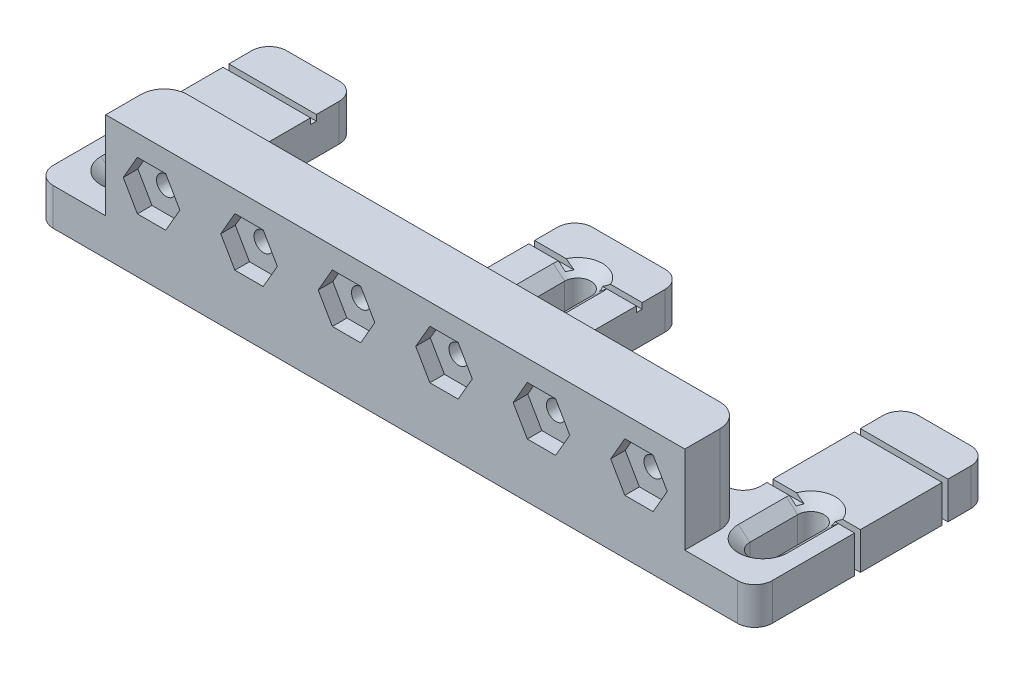
from build123d import *

# Parameters (mm, degrees)
SKETCH1_W                                    = 61.6
SKETCH1_H                                    = 40
BOSS_EXTRUDE1_DEPTH                          = 6.35
CSK_SLOT_FOR_8_FLAT_HEAD_MACHINE_SCREW_DEPTH = 6.35
FILLET1_R                                    = 3
SKETCH4_W                                    = 10
SKETCH4_H                                    = 15
BOSS_EXTRUDE2_DEPTH                          = 49.6
CUT_EXTRUDE1_DEPTH                           = 2.5
CUT_EXTRUDE2_DEPTH                           = 72.766165426
CUT_EXTRUDE2_DEPTH_BACK                      = 72.766165426
SKETCH7_R                                    = 1.65
FILLET3_R                                    = 4
SKETCH15_W                                   = 1
SKETCH15_H                                   = 2
SKETCH20_W                                   = 1
SKETCH20_H                                   = 2
CSK_START                                    = -1
CSK_SLOT_FOR_8_FLAT_HEAD_MACHINE_SC_4_DEPTH  = 22.35
CUT_EXTRUDE3_DEPTH                           = 67.479771505
CUT_EXTRUDE3_DEPTH_BACK                      = 67.479771505
FILLET4_R                                    = 3


with BuildPart() as part:
    # Sketch1 → Boss-Extrude1 (new body)
    with BuildSketch(Plane(origin=(0, 0, 0), x_dir=(1, 0, 0), z_dir=(0, 1, 0))):
        with Locations((-30.8, 0)):
            Rectangle(SKETCH1_W, SKETCH1_H)
    extrude(amount=BOSS_EXTRUDE1_DEPTH)

    # CSK SLOT for _8 Flat Head Machine Screw: read off the stored shape, not the designer's step
    # CSK SLOT for _8 Flat Head Machine Sc 2 → CSK SLOT for _8 Flat Head Machine Screw (cut)
    with BuildSketch(Plane(origin=(0, 0, 0), x_dir=(1, 0, 0), z_dir=(0, 1, 0))):
        with BuildLine():
            Line((-52.3521, -11.6021), (-52.3521, -3.3979))
            ThreePointArc((-52.3521, -3.3979), (-54.6, -1.15), (-56.8479, -3.3979))
            Line((-56.8479, -3.3979), (-56.8479, -11.6021))
            ThreePointArc((-56.8479, -11.6021), (-54.6, -13.85), (-52.3521, -11.6021))
        make_face()
    extrude(amount=CSK_SLOT_FOR_8_FLAT_HEAD_MACHINE_SCREW_DEPTH, mode=Mode.SUBTRACT)

    # CSK SLOT for _8 Flat Head Machine Sc 3: loft between two sections, ruled curve by curve
    csk_slot_for_8_flat_head_machine_sc_3_from = [
        Edge.make_three_point_arc((-52.3521, 4.698232376, 3.3979), (-53.010494667, 4.698232376, 1.808394667), (-54.6, 4.698232376, 1.15)),
        Edge.make_three_point_arc((-54.6, 4.698232376, 1.15), (-56.189505333, 4.698232376, 1.808394667), (-56.8479, 4.698232376, 3.3979)),
        Edge.make_three_point_arc((-56.8479, 4.698232376, 11.6021), (-56.189505333, 4.698232376, 13.191605333), (-54.6, 4.698232376, 13.85)),
        Edge.make_three_point_arc((-54.6, 4.698232376, 13.85), (-53.010494667, 4.698232376, 13.191605333), (-52.3521, 4.698232376, 11.6021)),
        Edge.make_line((-56.8479, 4.698232376, 3.3979), (-56.8479, 4.698232376, 11.6021)),
        Edge.make_line((-52.3521, 4.698232376, 3.3979), (-52.3521, 4.698232376, 11.6021)),
    ]
    csk_slot_for_8_flat_head_machine_sc_3_to = [
        Edge.make_three_point_arc((-50.3836, 6.35, 3.3979), (-51.618554968, 6.35, 0.416454968), (-54.6, 6.35, -0.8185)),
        Edge.make_three_point_arc((-54.6, 6.35, -0.8185), (-57.581445032, 6.35, 0.416454968), (-58.8164, 6.35, 3.3979)),
        Edge.make_three_point_arc((-58.8164, 6.35, 11.6021), (-57.581445032, 6.35, 14.583545032), (-54.6, 6.35, 15.8185)),
        Edge.make_three_point_arc((-54.6, 6.35, 15.8185), (-51.618554968, 6.35, 14.583545032), (-50.3836, 6.35, 11.6021)),
        Edge.make_line((-58.8164, 6.35, 3.3979), (-58.8164, 6.35, 11.6021)),
        Edge.make_line((-50.3836, 6.35, 3.3979), (-50.3836, 6.35, 11.6021)),
    ]
    csk_slot_for_8_flat_head_machine_sc_3 = Solid(Shell([*[Face.make_surface_from_curves(csk_slot_for_8_flat_head_machine_sc_3_from[k], csk_slot_for_8_flat_head_machine_sc_3_to[k]) for k in range(6)], Face(Wire(csk_slot_for_8_flat_head_machine_sc_3_from)), Face(Wire(csk_slot_for_8_flat_head_machine_sc_3_to))]))
    add(csk_slot_for_8_flat_head_machine_sc_3, mode=Mode.SUBTRACT)

    # Fillet1
    fillet1_edges = [part.edges().sort_by_distance(p)[0] for p in [
        (-61.6, 3.175, 20),
        (-61.6, 3.175, -20),
    ]]
    fillet(fillet1_edges, radius=FILLET1_R)

    # Sketch4 → Boss-Extrude2 (add)
    with BuildSketch(Plane(origin=(0, 0, 0), x_dir=(0, 0, -1), z_dir=(1, 0, 0))):
        with Locations((-15, 13.85)):
            Rectangle(SKETCH4_W, SKETCH4_H)
    extrude(amount=-BOSS_EXTRUDE2_DEPTH)

    # Sketch6 → Cut-Extrude1 (cut)
    with BuildSketch(Plane.XY.offset(20)):
        Polygon((-39.325386608, 9.35), (-36.900515478, 13.55), (-39.325386608, 17.75), (-44.175128869, 17.75), (-46.6, 13.55), (-44.175128869, 9.35), align=None)
        Polygon((-27.475644347, 17.75), (-29.900515478, 13.55), (-27.475644347, 9.35), (-22.625902086, 9.35), (-20.201030955, 13.55), (-22.625902086, 17.75), align=None)
        Polygon((-10.776159825, 17.75), (-13.201030955, 13.55), (-10.776159825, 9.35), (-5.926417563, 9.35), (-3.501546433, 13.55), (-5.926417563, 17.75), align=None)
    extrude(amount=-CUT_EXTRUDE1_DEPTH, mode=Mode.SUBTRACT)

    # Sketch7 → Cut-Extrude2 (cut, two sides: drawn at the far end of the back side and taken through both)
    with BuildSketch(Plane(origin=(0, 0, 10), x_dir=(-1, 0, 0), z_dir=(0, 0, -1)).offset(-CUT_EXTRUDE2_DEPTH_BACK)):
        with Locations((8.351288694, 13.55)):
            Circle(SKETCH7_R)
        with Locations((25.050773216, 13.55)):
            Circle(SKETCH7_R)
        with Locations((41.750257739, 13.55)):
            Circle(SKETCH7_R)
    extrude(amount=CUT_EXTRUDE2_DEPTH + CUT_EXTRUDE2_DEPTH_BACK, mode=Mode.SUBTRACT)

    # Fillet3
    fillet3_edges = [part.edges().sort_by_distance(p)[0] for p in [
        (-49.6, 13.85, 10),
    ]]
    fillet(fillet3_edges, radius=FILLET3_R)

    # Cut-Sweep1: sweep along a path in Sketch13
    with BuildLine(Plane(origin=(0, 0, 2.412734338), x_dir=(-1, 0, 0), z_dir=(0, 0, -1))) as cut_sweep1_path:
        Line((0, 6.35), (61.6, 6.35))
        Line((61.6, 6.35), (61.6, 0))
    # Sketch15 → Cut-Sweep1 (sweep, cut)
    with BuildSketch(Plane(origin=(0, 0, 0), x_dir=(0, 0, -1), z_dir=(1, 0, 0))):
        with Locations((-2.412734338, 6.35)):
            Rectangle(SKETCH15_W, SKETCH15_H)
    sweep(path=cut_sweep1_path.line, transition=Transition.RIGHT, mode=Mode.SUBTRACT)

    # Cut-Sweep2: sweep along a path in Sketch19
    with BuildLine(Plane(origin=(0, 0, -12.587265662), x_dir=(-1, 0, 0), z_dir=(0, 0, -1))) as cut_sweep2_path:
        Line((0, 6.35), (61.6, 6.35))
        Line((61.6, 6.35), (61.6, 0))
    # Sketch20 → Cut-Sweep2 (sweep, cut)
    with BuildSketch(Plane(origin=(0, 0, 0), x_dir=(0, 0, -1), z_dir=(1, 0, 0))):
        with Locations((12.587265662, 6.35)):
            Rectangle(SKETCH20_W, SKETCH20_H)
    sweep(path=cut_sweep2_path.line, transition=Transition.RIGHT, mode=Mode.SUBTRACT)

    # CSK SLOT for _8 Flat Head Machine Sc 4: read off the stored shape, not the designer's step
    # CSK SLOT for _8 Flat Head Machine Sc 4 o → CSK SLOT for _8 Flat Head Machine Sc 4 (cut)
    with BuildSketch(Plane(origin=(0, 0, 0), x_dir=(1, 0, 0), z_dir=(0, 1, 0)).offset(CSK_START)):
        with BuildLine():
            ThreePointArc((0, 13.526188256), (-1.589505333, 12.867793589), (-2.2479, 11.278288256))
            Line((-2.2479, 11.278288256), (-2.2479, 3.074088256))
            ThreePointArc((-2.2479, 3.074088256), (-1.589505333, 1.484582923), (0, 0.826188256))
            Line((0, 0.826188256), (0, 13.526188256))
        make_face()
    extrude(amount=CSK_SLOT_FOR_8_FLAT_HEAD_MACHINE_SC_4_DEPTH, mode=Mode.SUBTRACT)

    # CSK SLOT for _8 Flat Head Machine Sc 4 2: loft between two sections, ruled curve by curve
    csk_slot_for_8_flat_head_machine_sc_4_2_from = [
        Edge.make_three_point_arc((-2.2479, 4.698232376, -3.074088256), (-1.589505333, 4.698232376, -1.484582923), (0, 4.698232376, -0.826188256)),
        Edge.make_three_point_arc((0, 4.698232376, -13.526188256), (-1.589505333, 4.698232376, -12.867793589), (-2.2479, 4.698232376, -11.278288256)),
        Edge.make_line((-2.2479, 4.698232376, -11.278288256), (-2.2479, 4.698232376, -3.074088256)),
        Edge.make_line((0, 4.698232376, -13.526188256), (0, 4.698232376, -0.826188256)),
    ]
    csk_slot_for_8_flat_head_machine_sc_4_2_to = [
        Edge.make_three_point_arc((-4.2164, 6.35, -3.074088256), (-2.981445032, 6.35, -0.092643224), (0, 6.35, 1.142311744)),
        Edge.make_three_point_arc((0, 6.35, -15.494688256), (-2.981445032, 6.35, -14.259733288), (-4.2164, 6.35, -11.278288256)),
        Edge.make_line((-4.2164, 6.35, -11.278288256), (-4.2164, 6.35, -3.074088256)),
        Edge.make_line((0, 6.35, -15.494688256), (0, 6.35, 1.142311744)),
    ]
    csk_slot_for_8_flat_head_machine_sc_4_2 = Solid(Shell([*[Face.make_surface_from_curves(csk_slot_for_8_flat_head_machine_sc_4_2_from[k], csk_slot_for_8_flat_head_machine_sc_4_2_to[k]) for k in range(4)], Face(Wire(csk_slot_for_8_flat_head_machine_sc_4_2_from)), Face(Wire(csk_slot_for_8_flat_head_machine_sc_4_2_to))]))
    add(csk_slot_for_8_flat_head_machine_sc_4_2, mode=Mode.SUBTRACT)

    # Sketch23 → Cut-Extrude3 (cut, two sides: drawn at the far end of the back side and taken through both)
    with BuildSketch(Plane(origin=(0, 6.35, 0), x_dir=(1, 0, 0), z_dir=(0, 1, 0)).offset(-CUT_EXTRUDE3_DEPTH_BACK)):
        with BuildLine():
            Line((-46.6, 20), (-9.2164, 20))
            Line((-9.2164, 20), (-9.2164, -4))
            ThreePointArc((-9.2164, -4), (-10.095079656, -6.121320344), (-12.2164, -7))
            Line((-12.2164, -7), (-43.6, -7))
            ThreePointArc((-43.6, -7), (-45.721320344, -6.121320344), (-46.6, -4))
            Line((-46.6, -4), (-46.6, 20))
        make_face()
    extrude(amount=CUT_EXTRUDE3_DEPTH + CUT_EXTRUDE3_DEPTH_BACK, mode=Mode.SUBTRACT)

    # Fillet4
    fillet4_edges = [part.edges().sort_by_distance(p)[0] for p in [
        (-46.6, 3.175, -20),
        (-9.2164, 3.175, -20),
    ]]
    fillet(fillet4_edges, radius=FILLET4_R)

    # Mirror1: part across face


with BuildPart() as part_1:
    add(part.part)
    add(part.part.mirror(Plane(origin=(0, 8.876685363, 12.573097904), x_dir=(0, 0, 1), z_dir=(1, 0, 0))))


solid = part_1.part
